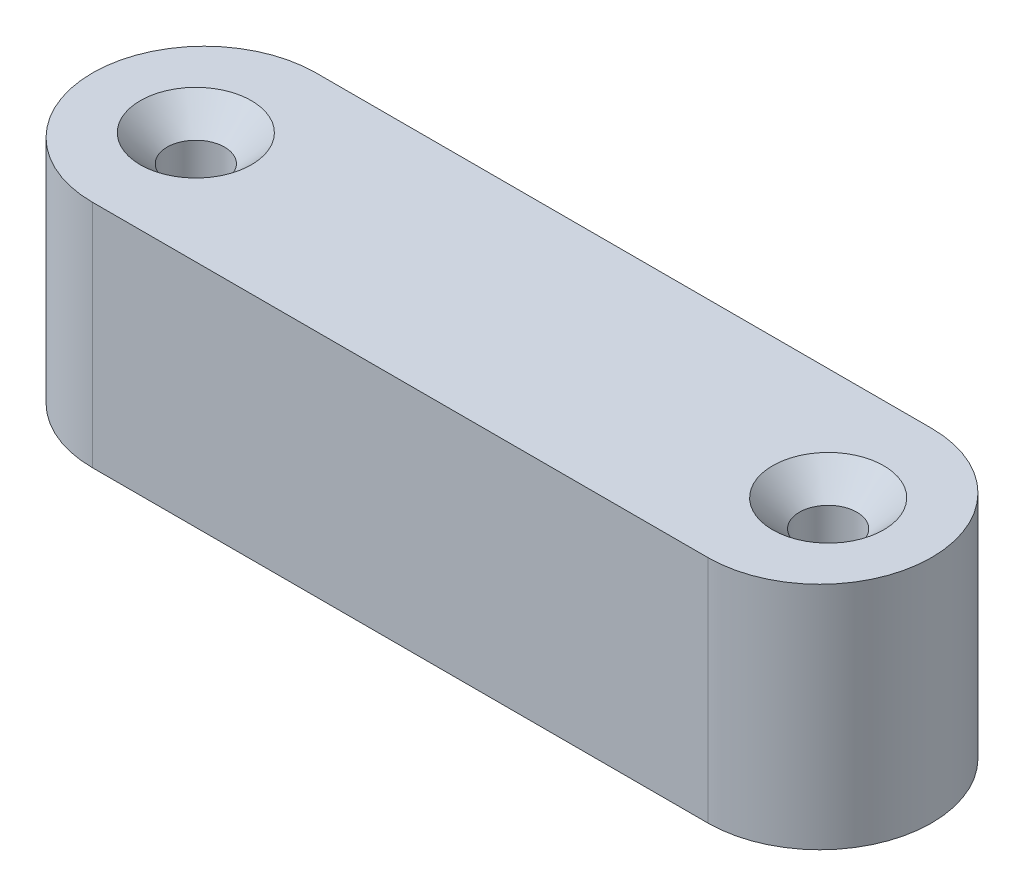
from build123d import *

# Parameters (mm, degrees)
SKETCH1_R           = 1.905
BOSS_EXTRUDE1_DEPTH = 15.24
CHAMFER1_SIZE       = 1.778


with BuildPart() as part:
    # Sketch1 → Boss-Extrude1 (new body)
    with BuildSketch(Plane(origin=(0, 0, 0), x_dir=(1, 0, 0), z_dir=(0, 1, 0))):
        with BuildLine():
            Line((-20.3962, 7.4168), (20.3962, 7.4168))
            ThreePointArc((20.3962, 7.4168), (27.813, 0), (20.3962, -7.4168))
            Line((20.3962, -7.4168), (-20.3962, -7.4168))
            ThreePointArc((-20.3962, -7.4168), (-27.813, 0), (-20.3962, 7.4168))
        make_face()
        with Locations((-20.955, 0)):
            Circle(SKETCH1_R, mode=Mode.SUBTRACT)
        with Locations((20.955, 0)):
            Circle(SKETCH1_R, mode=Mode.SUBTRACT)
    extrude(amount=BOSS_EXTRUDE1_DEPTH)

    # Chamfer1
    chamfer1_edges = [part.edges().sort_by_distance(p)[0] for p in [
        (19.05, 15.24, 0),
        (-22.86, 15.24, 0),
    ]]
    chamfer(chamfer1_edges, length=CHAMFER1_SIZE)


solid = part.part
